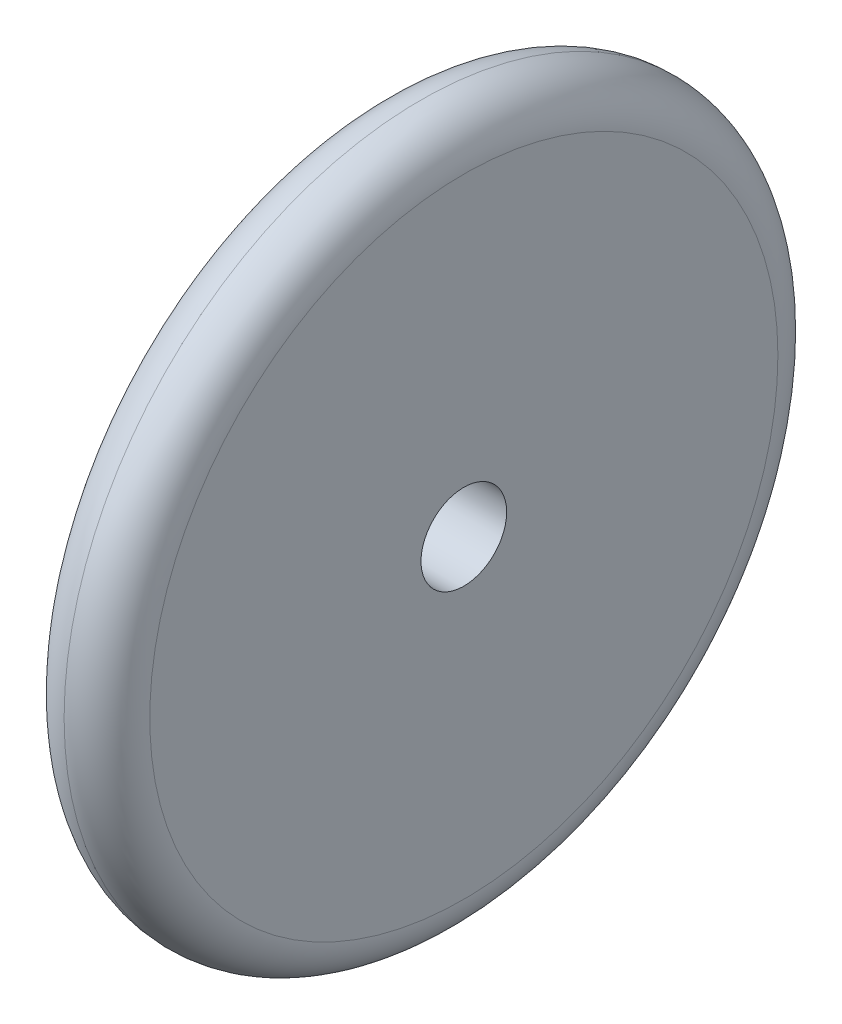
from build123d import *

# Parameters (mm, degrees)
SKETCH1_R           = 125
BOSS_EXTRUDE1_DEPTH = 30
FILLET1_R           = 15
SKETCH2_R           = 15
CUT_EXTRUDE1_DEPTH  = 180.30421084


with BuildPart() as part:
    # Sketch1 → Boss-Extrude1 (new body)
    with BuildSketch(Plane(origin=(0, 0, 0), x_dir=(0, 0, -1), z_dir=(1, 0, 0))):
        Circle(SKETCH1_R)
    extrude(amount=BOSS_EXTRUDE1_DEPTH)

    # Fillet1
    fillet1_edges = [part.edges().sort_by_distance(p)[0] for p in [
        (0, 0, 125),
        (30, 0, 125),
    ]]
    fillet(fillet1_edges, radius=FILLET1_R - 0.0001)  # a hair under: the kernel refuses the full size

    # Sketch2 → Cut-Extrude1 (cut, through all)
    with BuildSketch(Plane(origin=(30, 0, 0), x_dir=(0, 0, -1), z_dir=(1, 0, 0))):
        Circle(SKETCH2_R)
    extrude(amount=-CUT_EXTRUDE1_DEPTH, mode=Mode.SUBTRACT)


solid = part.part
